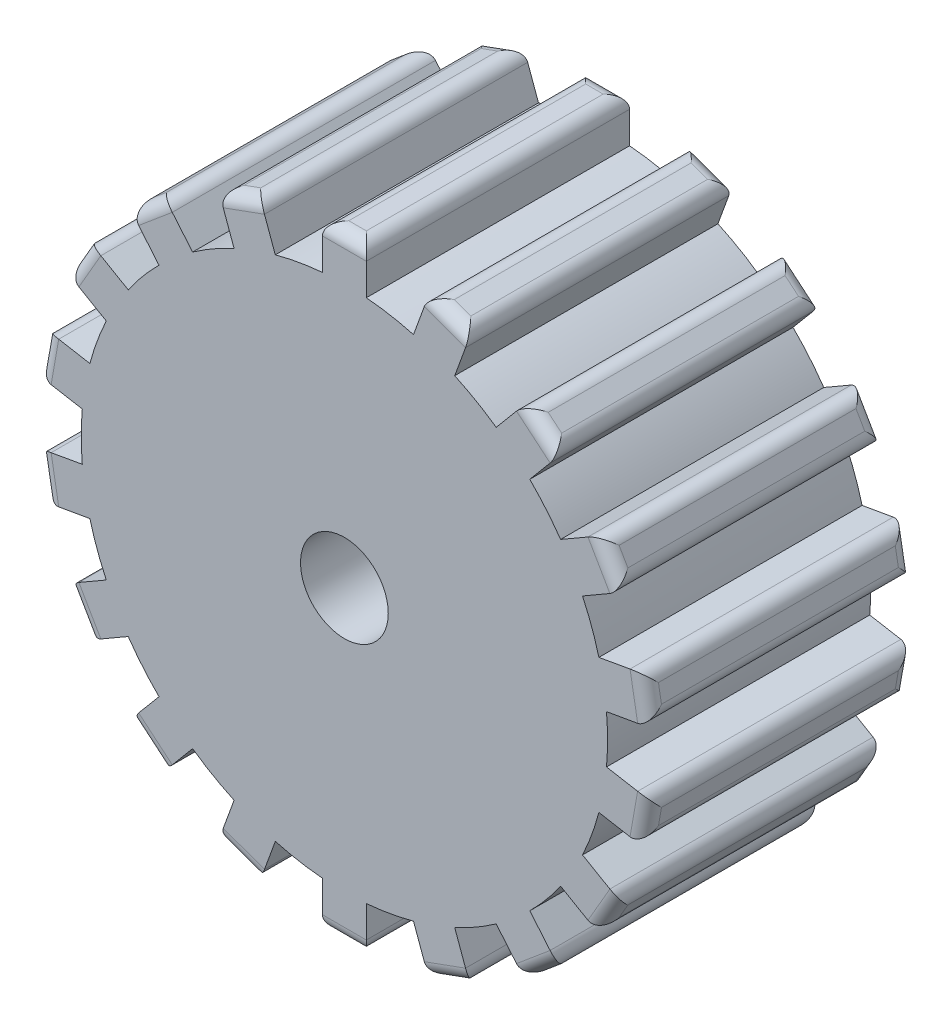
from build123d import *

# Parameters (mm, degrees)
SKETCH2_R                = 60
BOSS_EXTRUDE1_DEPTH      = 60
SKETCH3_W                = 10
SKETCH3_H                = 10.47851478
BOSS_EXTRUDE2_DEPTH      = 60
FILLET2_R                = 3
CIRPATTERN1_COUNT        = 18
FILLET2_OF_CIRPATTERN1_R = 3
SKETCH4_R                = 10
CUT_EXTRUDE1_DEPTH       = 60


with BuildPart() as part:
    # Sketch2 → Boss-Extrude1 (new body)
    with BuildSketch(Plane.XY):
        Circle(SKETCH2_R)
    extrude(amount=BOSS_EXTRUDE1_DEPTH)

    # Sketch3 → Boss-Extrude2 (add)
    with BuildSketch(Plane.XY.offset(60)):
        with Locations((0, 64.76074261)):
            Rectangle(SKETCH3_W, SKETCH3_H)
    boss_extrude2 = extrude(amount=-BOSS_EXTRUDE2_DEPTH)

    # Fillet2
    fillet2_edges = [part.edges().sort_by_distance(p)[0] for p in [
        (-5, 70, 30),
        (0, 70, 0),
        (5, 70, 30),
        (0, 70, 60),
    ]]
    fillet(fillet2_edges, radius=FILLET2_R)

    # CirPattern1: Boss-Extrude2 ×18 about axis
    cirpattern1_axis = Axis((0, 0, 60), (0, 0, -1))
    for i in range(1, CIRPATTERN1_COUNT):
        add(boss_extrude2.rotate(cirpattern1_axis, i * 360 / CIRPATTERN1_COUNT))

    # Fillet2 of CirPattern1
    fillet2_of_cirpattern1_edges = [part.edges().sort_by_distance(p)[0] for p in [
        (19.242946929, 67.488584172, 30),
        (23.941410033, 65.778483455, 0),
        (28.639873137, 64.068382738, 30),
        (23.941410033, 65.778483455, 60),
        (41.164910462, 56.837049067, 30),
        (44.995132678, 53.623111018, 0),
        (48.825354894, 50.40917297, 30),
        (44.995132678, 53.623111018, 60),
        (58.121778265, 39.330127019, 30),
        (60.621778265, 35, 0),
        (63.121778265, 30.669872981, 30),
        (60.621778265, 35, 60),
        (68.068301823, 17.079411202, 30),
        (68.936542711, 12.155372437, 0),
        (69.804783599, 7.231333672, 30),
        (68.936542711, 12.155372437, 60),
        (69.804783599, -7.231333672, 30),
        (68.936542711, -12.155372437, 0),
        (68.068301823, -17.079411202, 30),
        (68.936542711, -12.155372437, 60),
        (63.121778265, -30.669872981, 30),
        (60.621778265, -35, 0),
        (58.121778265, -39.330127019, 30),
        (60.621778265, -35, 60),
        (48.825354894, -50.40917297, 30),
        (44.995132678, -53.623111018, 0),
        (41.164910462, -56.837049067, 30),
        (44.995132678, -53.623111018, 60),
        (28.639873137, -64.068382738, 30),
        (23.941410033, -65.778483455, 0),
        (19.242946929, -67.488584172, 30),
        (23.941410033, -65.778483455, 60),
        (5, -70, 30),
        (0, -70, 0),
        (-5, -70, 30),
        (0, -70, 60),
        (-19.242946929, -67.488584172, 30),
        (-23.941410033, -65.778483455, 0),
        (-28.639873137, -64.068382738, 30),
        (-23.941410033, -65.778483455, 60),
        (-41.164910462, -56.837049067, 30),
        (-44.995132678, -53.623111018, 0),
        (-48.825354894, -50.40917297, 30),
        (-44.995132678, -53.623111018, 60),
        (-58.121778265, -39.330127019, 30),
        (-60.621778265, -35, 0),
        (-63.121778265, -30.669872981, 30),
        (-60.621778265, -35, 60),
        (-68.068301823, -17.079411202, 30),
        (-68.936542711, -12.155372437, 0),
        (-69.804783599, -7.231333672, 30),
        (-68.936542711, -12.155372437, 60),
        (-69.804783599, 7.231333672, 30),
        (-68.936542711, 12.155372437, 0),
        (-68.068301823, 17.079411202, 30),
        (-68.936542711, 12.155372437, 60),
        (-63.121778265, 30.669872981, 30),
        (-60.621778265, 35, 0),
        (-58.121778265, 39.330127019, 30),
        (-60.621778265, 35, 60),
        (-48.825354894, 50.40917297, 30),
        (-44.995132678, 53.623111018, 0),
        (-41.164910462, 56.837049067, 30),
        (-44.995132678, 53.623111018, 60),
        (-28.639873137, 64.068382738, 30),
        (-23.941410033, 65.778483455, 0),
        (-19.242946929, 67.488584172, 30),
        (-23.941410033, 65.778483455, 60),
    ]]
    fillet(fillet2_of_cirpattern1_edges, radius=FILLET2_OF_CIRPATTERN1_R)

    # Sketch4 → Cut-Extrude1 (cut)
    with BuildSketch(Plane.XY.offset(60)):
        Circle(SKETCH4_R)
    extrude(amount=-CUT_EXTRUDE1_DEPTH, mode=Mode.SUBTRACT)


solid = part.part
